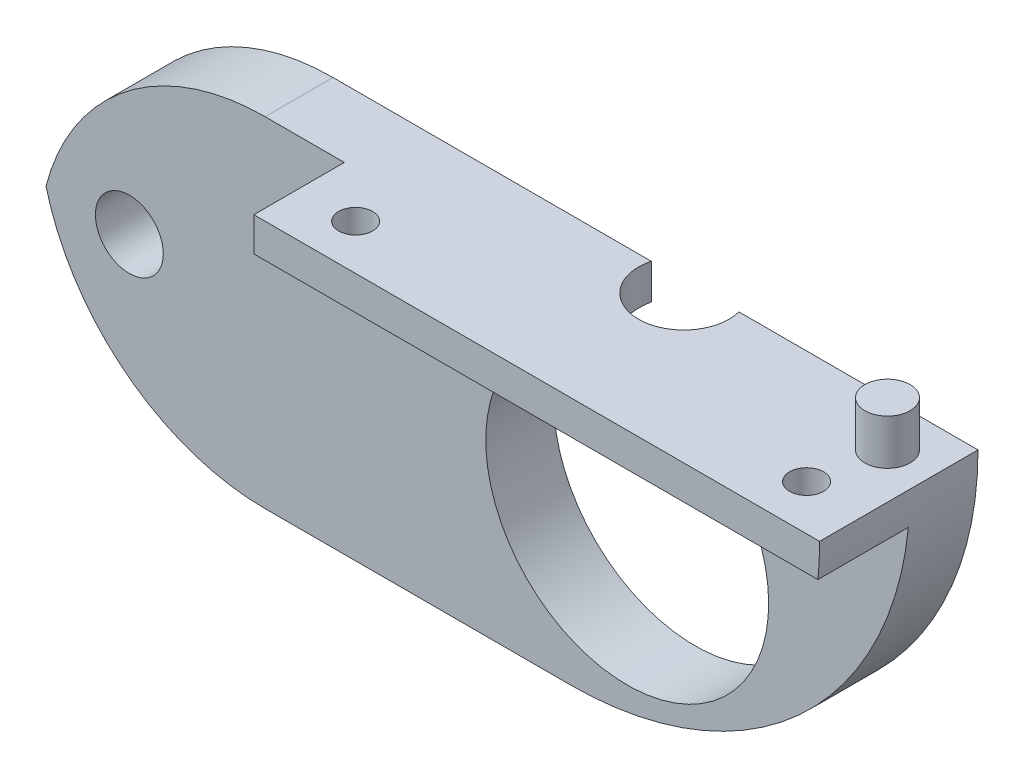
from build123d import *

# Parameters (mm, degrees)
ESQUISSE1_W                  = 77
ESQUISSE1_H                  = 30
BOSS_EXTRU_1_DEPTH           = 6
ESQUISSE2_R                  = 12.5
ESQUISSE2_R_2                = 3
ENL_V_MAT_EXTRU_1_DEPTH      = 6
ESQUISSE3_W                  = 50
ESQUISSE3_H                  = 3
BOSS_EXTRU_2_DEPTH           = 8
ENL_V_MAT_EXTRU_2_REACH      = 85.815
ENL_V_MAT_EXTRU_2_END_RADIUS = 12.5
ESQUISSE5_R                  = 4
CONG_1_R                     = 20
CONG_2_R                     = 30
ESQUISSE6_R                  = 2
BOSS_EXTRU_3_DEPTH           = 4
ESQUISSE7_R                  = 1.5
ENL_V_MAT_EXTRU_3_DEPTH      = 10


with BuildPart() as part:
    # Esquisse1 → Boss.-Extru.1 (new body)
    with BuildSketch(Plane.XY):
        with Locations((-38.5, 15)):
            Rectangle(ESQUISSE1_W, ESQUISSE1_H)
    extrude(amount=BOSS_EXTRU_1_DEPTH)

    # Esquisse2 → Enlèv. mat.-Extru.1 (cut)
    with BuildSketch(Plane.XY.offset(6)):
        with Locations((-25, 15)):
            Circle(ESQUISSE2_R)
        with Locations((-69, 15)):
            Circle(ESQUISSE2_R_2)
    extrude(amount=-ENL_V_MAT_EXTRU_1_DEPTH, mode=Mode.SUBTRACT)

    # Esquisse3 → Boss.-Extru.2 (add)
    with BuildSketch(Plane.XY.offset(6)):
        with Locations((-25, 28.5)):
            Rectangle(ESQUISSE3_W, ESQUISSE3_H)
    extrude(amount=BOSS_EXTRU_2_DEPTH)

    # Enlèv. mat.-Extru.2: up to this cylinder (the profile starts outside it)
    enl_v_mat_extru_2_end = Plane(origin=(-25, 15, 1), z_dir=(0, 0, 1)) * Cylinder(ENL_V_MAT_EXTRU_2_END_RADIUS, 197.63, mode=Mode.PRIVATE)
    # Esquisse5 → Enlèv. mat.-Extru.2 (cut, up to the surface)
    with BuildSketch(Plane(origin=(0, 30, 0), x_dir=(1, 0, 0), z_dir=(0, 1, 0)), mode=Mode.PRIVATE) as enl_v_mat_extru_2_sk1:
        with Locations((-25, -1)):
            Circle(ESQUISSE5_R)
    enl_v_mat_extru_2_tool1 = extrude(enl_v_mat_extru_2_sk1.sketch, amount=-ENL_V_MAT_EXTRU_2_REACH, mode=Mode.PRIVATE) - enl_v_mat_extru_2_end
    add(enl_v_mat_extru_2_tool1.solids().sort_by_distance((-25, 30, 1))[0], mode=Mode.SUBTRACT)

    # Congé1
    # the kernel refuses this fillet: 20 mm, written as the material it takes off along each edge
    with BuildSketch(Plane(origin=(-77, 30, -50), x_dir=(1, 0, 0), z_dir=(0, 0, 1))) as cong_1_piece_1:
        with BuildLine():
            CenterArc((CONG_1_R, -CONG_1_R), CONG_1_R, 90, 90)
            Line((0, -CONG_1_R), (0, 0))
            Line((0, 0), (CONG_1_R, 0))
        make_face()
    extrude(amount=106, mode=Mode.SUBTRACT)
    with BuildSketch(Plane(origin=(-77, 0, -50), x_dir=(1, 0, 0), z_dir=(0, 0, 1))) as cong_1_piece_2:
        with BuildLine():
            CenterArc((CONG_1_R, CONG_1_R), CONG_1_R, 180, 90)
            Line((0, CONG_1_R), (0, 0))
            Line((0, 0), (CONG_1_R, 0))
        make_face()
    extrude(amount=106, mode=Mode.SUBTRACT)

    # Congé2
    # the kernel refuses this fillet: 30 mm, written as the material it takes off along each edge
    with BuildSketch(Plane(origin=(0, 0, -75), x_dir=(-1, 0, 0), z_dir=(0, 0, 1))) as cong_2_piece_1:
        with BuildLine():
            CenterArc((CONG_2_R, -CONG_2_R), CONG_2_R, 90, 90)
            Line((0, -CONG_2_R), (0, 0))
            Line((0, 0), (CONG_2_R, 0))
        make_face()
    extrude(amount=156, mode=Mode.SUBTRACT)

    # Esquisse6 → Boss.-Extru.3 (add)
    with BuildSketch(Plane(origin=(0, 30, 0), x_dir=(1, 0, 0), z_dir=(0, 1, 0))):
        with Locations((-4, -4)):
            Circle(ESQUISSE6_R)
    extrude(amount=BOSS_EXTRU_3_DEPTH)

    # Esquisse7 → Enlèv. mat.-Extru.3 (cut)
    with BuildSketch(Plane.XZ.offset(-27)):
        with Locations((-45, 10)):
            Circle(ESQUISSE7_R)
        with Locations((-5.150376887, 10)):
            Circle(ESQUISSE7_R)
    extrude(amount=-ENL_V_MAT_EXTRU_3_DEPTH, mode=Mode.SUBTRACT)


solid = part.part
